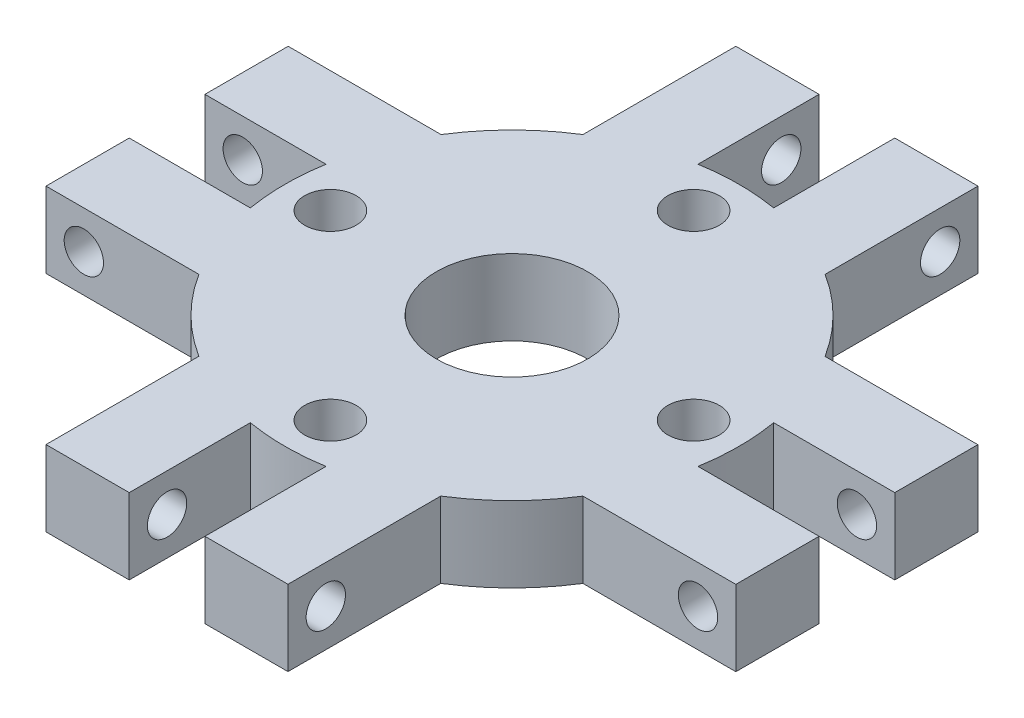
from build123d import *

# Parameters (mm, degrees)
BOSS_EXTRUDE1_DEPTH = 6.35
SKETCH2_R           = 1.651
CUT_EXTRUDE1_DEPTH  = 23.368
SKETCH3_R           = 1.651
CUT_EXTRUDE2_DEPTH  = 23.368
SKETCH4_R           = 1.651
CUT_EXTRUDE3_DEPTH  = 23.368
SKETCH5_R           = 1.651
CUT_EXTRUDE4_DEPTH  = 23.368
SKETCH6_R           = 6.35
CUT_EXTRUDE5_DEPTH  = 14.3002
SKETCH7_R           = 2.159
CUT_EXTRUDE6_DEPTH  = 13.462


with BuildPart() as part:
    # Sketch1 → Boss-Extrude1 (new body)
    with BuildSketch(Plane(origin=(0, 0, 0), x_dir=(1, 0, 0), z_dir=(0, 1, 0))):
        with BuildLine():
            Line((-3.175, 18.783553311), (-3.175, 28.943553311))
            Line((-3.175, 28.943553311), (-10.16, 28.943553311))
            Line((-10.16, 28.943553311), (-10.16, 16.114493476))
            ThreePointArc((-10.16, 16.114493476), (-13.470384182, 13.470384182), (-16.114493476, 10.16))
            Line((-16.114493476, 10.16), (-28.943553311, 10.16))
            Line((-28.943553311, 10.16), (-28.943553311, 3.175))
            Line((-28.943553311, 3.175), (-18.783553311, 3.175))
            ThreePointArc((-18.783553311, 3.175), (-19.05, 0), (-18.783553311, -3.175))
            Line((-18.783553311, -3.175), (-28.943553311, -3.175))
            Line((-28.943553311, -3.175), (-28.943553311, -10.16))
            Line((-28.943553311, -10.16), (-16.114493476, -10.16))
            ThreePointArc((-16.114493476, -10.16), (-13.470384182, -13.470384182), (-10.16, -16.114493476))
            Line((-10.16, -16.114493476), (-10.16, -28.943553311))
            Line((-10.16, -28.943553311), (-3.175, -28.943553311))
            Line((-3.175, -28.943553311), (-3.175, -18.783553311))
            ThreePointArc((-3.175, -18.783553311), (0, -19.05), (3.175, -18.783553311))
            Line((3.175, -18.783553311), (3.175, -28.943553311))
            Line((3.175, -28.943553311), (10.144252899, -28.943553311))
            Line((10.144252899, -28.943553311), (10.144252899, -16.124411094))
            ThreePointArc((10.144252899, -16.124411094), (13.463802963, -13.476962186), (16.114493476, -10.16))
            Line((16.114493476, -10.16), (28.943553311, -10.16))
            Line((28.943553311, -10.16), (28.943553311, -3.175))
            Line((28.943553311, -3.175), (18.783553311, -3.175))
            ThreePointArc((18.783553311, -3.175), (19.05, 0), (18.783553311, 3.175))
            Line((18.783553311, 3.175), (28.943553311, 3.175))
            Line((28.943553311, 3.175), (28.943553311, 10.146623982))
            Line((28.943553311, 10.146623982), (16.122919145, 10.146623982))
            ThreePointArc((16.122919145, 10.146623982), (13.475972183, 13.464793861), (10.16, 16.114493476))
            Line((10.16, 16.114493476), (10.16, 28.943553311))
            Line((10.16, 28.943553311), (3.175, 28.943553311))
            Line((3.175, 28.943553311), (3.175, 18.783553311))
            ThreePointArc((3.175, 18.783553311), (0, 19.05), (-3.175, 18.783553311))
        make_face()
    extrude(amount=BOSS_EXTRUDE1_DEPTH)

    # Sketch2 → Cut-Extrude1 (cut)
    with BuildSketch(Plane(origin=(10.16, 0, 0), x_dir=(0, 0, -1), z_dir=(1, 0, 0))):
        with Locations((25.768553311, 3.175)):
            Circle(SKETCH2_R)
    extrude(amount=-CUT_EXTRUDE1_DEPTH, mode=Mode.SUBTRACT)

    # Sketch3 → Cut-Extrude2 (cut)
    with BuildSketch(Plane(origin=(0, 0, -10.146623982), x_dir=(-1, 0, 0), z_dir=(0, 0, -1))):
        with Locations((-25.768553311, 3.175)):
            Circle(SKETCH3_R)
    extrude(amount=-CUT_EXTRUDE2_DEPTH, mode=Mode.SUBTRACT)

    # Sketch4 → Cut-Extrude3 (cut)
    with BuildSketch(Plane(origin=(10.144252899, 0, 0), x_dir=(0, 0, -1), z_dir=(1, 0, 0))):
        with Locations((-25.768553311, 3.175)):
            Circle(SKETCH4_R)
    extrude(amount=-CUT_EXTRUDE3_DEPTH, mode=Mode.SUBTRACT)

    # Sketch5 → Cut-Extrude4 (cut)
    with BuildSketch(Plane.XY.offset(10.16)):
        with Locations((-25.768553311, 3.175)):
            Circle(SKETCH5_R)
    extrude(amount=-CUT_EXTRUDE4_DEPTH, mode=Mode.SUBTRACT)

    # Sketch6 → Cut-Extrude5 (cut)
    with BuildSketch(Plane(origin=(0, 6.35, 0), x_dir=(1, 0, 0), z_dir=(0, 1, 0))):
        Circle(SKETCH6_R)
    extrude(amount=-CUT_EXTRUDE5_DEPTH, mode=Mode.SUBTRACT)

    # Sketch7 → Cut-Extrude6 (cut)
    with BuildSketch(Plane.XZ):
        with Locations((0, 15.24)):
            Circle(SKETCH7_R)
        with Locations((15.24, 0)):
            Circle(SKETCH7_R)
        with Locations((0, -15.24)):
            Circle(SKETCH7_R)
        with Locations((-15.24, 0)):
            Circle(SKETCH7_R)
    extrude(amount=-CUT_EXTRUDE6_DEPTH, mode=Mode.SUBTRACT)


solid = part.part
